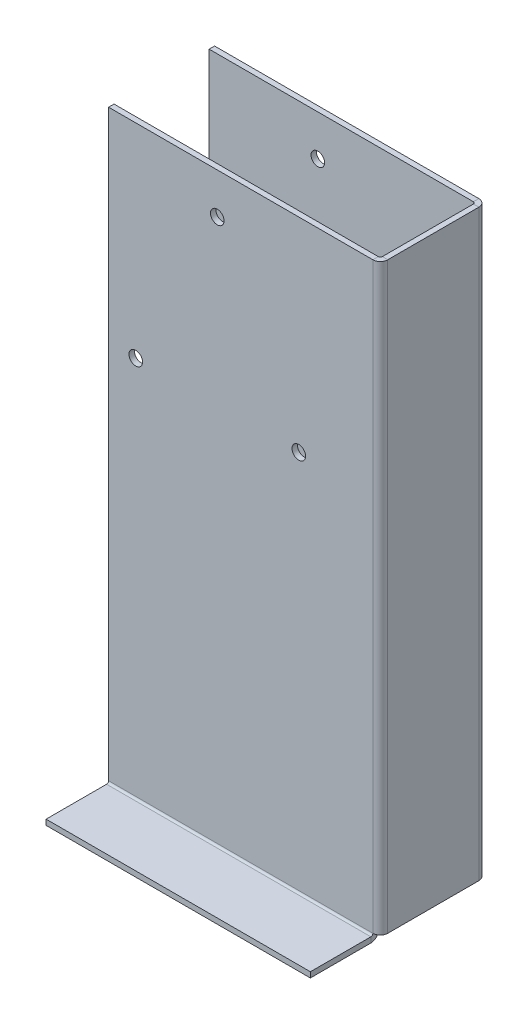
from build123d import *

# Parameters (mm, degrees)
SKETCH1_W                    = 100
SKETCH1_H                    = 214.69
BASE_FLANGE1_DEPTH           = 2
EDGE_FLANGE1_STRIP_W         = 9.4732
EDGE_FLANGE1_STRIP_H         = 2
EDGE_FLANGE1_STRIP_CUT_DEPTH = 214.69
EDGE_FLANGE1_DEPTH           = 214.69
EDGE_FLANGE2_STRIP_W         = 9.4732
EDGE_FLANGE2_STRIP_H         = 2
EDGE_FLANGE2_STRIP_CUT_DEPTH = 214.69
EDGE_FLANGE2_DEPTH           = 214.69
EDGE_FLANGE3_DEPTH           = 97.2634
EDGE_FLANGE3_BEND_DEPTH      = 97.2634
SKETCH18_W                   = 29
SKETCH18_H                   = 2.7366
SKETCH18_W_2                 = 27
CUT_EXTRUDE1_DEPTH           = 25
CUT_EXTRUDE2_REACH           = 246.818
SKETCH19_R                   = 2.5


# Sheet-metal steps are written as plain solids
with BuildPart() as part:
    # Sketch1 → Base-Flange1 (new body)
    with BuildSketch(Plane.XY):
        with Locations((50, 107.345)):
            Rectangle(SKETCH1_W, SKETCH1_H)
    extrude(amount=-BASE_FLANGE1_DEPTH)

    # Edge-Flange1 strip (across the edge) → Edge-Flange1 strip cut (cut)
    with BuildSketch(Plane(origin=(100, 214.69, -2), x_dir=(-1, 0, 0), z_dir=(0, -1, 0))):
        with Locations((-2, -1)):
            Rectangle(EDGE_FLANGE1_STRIP_W, EDGE_FLANGE1_STRIP_H)
    extrude(amount=EDGE_FLANGE1_STRIP_CUT_DEPTH, mode=Mode.SUBTRACT)

    # Edge-Flange1 section (across the edge) → Edge-Flange1 (add)
    with BuildSketch(Plane(origin=(100, 214.69, -2), x_dir=(-1, 0, 0), z_dir=(0, -1, 0))):
        with BuildLine():
            Line((0, 0.7366), (0, 37))
            Line((0, 37), (2, 37))
            Line((2, 37), (2, 0.7366))
            ThreePointArc((2, 0.7366), (2.215745145, 0.215745145), (2.7366, 0))
            Line((2.7366, 0), (2.7366, -2))
            ThreePointArc((2.7366, -2), (0.801531583, -1.198468417), (0, 0.7366))
        make_face()
    extrude(amount=EDGE_FLANGE1_DEPTH)

    # Edge-Flange2 strip (across the edge) → Edge-Flange2 strip cut (cut)
    with BuildSketch(Plane(origin=(98, 214.69, -39), x_dir=(0, 0, 1), z_dir=(0, -1, 0))):
        with Locations((-2, -1)):
            Rectangle(EDGE_FLANGE2_STRIP_W, EDGE_FLANGE2_STRIP_H)
    extrude(amount=EDGE_FLANGE2_STRIP_CUT_DEPTH, mode=Mode.SUBTRACT)

    # Edge-Flange2 section (across the edge) → Edge-Flange2 (add)
    with BuildSketch(Plane(origin=(98, 214.69, -39), x_dir=(0, 0, 1), z_dir=(0, -1, 0))):
        with BuildLine():
            Line((0, 0.7366), (0, 98))
            Line((0, 98), (2, 98))
            Line((2, 98), (2, 0.7366))
            ThreePointArc((2, 0.7366), (2.215745145, 0.215745145), (2.7366, 0))
            Line((2.7366, 0), (2.7366, -2))
            ThreePointArc((2.7366, -2), (0.801531583, -1.198468417), (0, 0.7366))
        make_face()
    extrude(amount=EDGE_FLANGE2_DEPTH)

    # Edge-Flange3 section (across the edge) → Edge-Flange3 (add)
    with BuildSketch(Plane(origin=(0, -0.7366, 0), x_dir=(0, 1, 0), z_dir=(1, 0, 0))):
        with BuildLine():
            Line((-2, 0.7366), (-2, 23))
            Line((-2, 23), (0, 23))
            Line((0, 23), (0, 0.7366))
            ThreePointArc((0, 0.7366), (0.215745145, 0.215745145), (0.7366, 0))
            Line((0.7366, 0), (0.7366, -2))
            ThreePointArc((0.7366, -2), (-1.198468417, -1.198468417), (-2, 0.7366))
        make_face()
    extrude(amount=EDGE_FLANGE3_DEPTH)

    # Edge-Flange3 section 2 (across the edge) → Edge-Flange3 bend (add)
    with BuildSketch(Plane(origin=(97.2634, -0.7366, -39), x_dir=(0, 1, 0), z_dir=(-1, 0, 0))):
        with BuildLine():
            Line((-2, 0.7366), (-2, 23))
            Line((-2, 23), (0, 23))
            Line((0, 23), (0, 0.7366))
            ThreePointArc((0, 0.7366), (0.215745145, 0.215745145), (0.7366, 0))
            Line((0.7366, 0), (0.7366, -2))
            ThreePointArc((0.7366, -2), (-1.198468417, -1.198468417), (-2, 0.7366))
        make_face()
    extrude(amount=EDGE_FLANGE3_BEND_DEPTH)

    # Sketch18 → Cut-Extrude1 (cut)
    with BuildSketch(Plane(origin=(0, -57.7366, -62), x_dir=(1, 0, 0), z_dir=(0, 0, 1))):
        with Locations((82.7634, 56.3683)):
            Rectangle(SKETCH18_W, SKETCH18_H)
        with Locations((13.5, 56.3683)):
            Rectangle(SKETCH18_W_2, SKETCH18_H)
    extrude(amount=CUT_EXTRUDE1_DEPTH, mode=Mode.SUBTRACT)

    # Cut-Extrude2: up to this face of the body (flat: up to its plane)
    cut_extrude2_end = Plane(part.part.faces().sort_by_distance((48.6317, 107.345, -39))[0])
    # Sketch19 → Cut-Extrude2 (cut, up to the picked face)
    with BuildSketch(Plane.XY, mode=Mode.PRIVATE) as cut_extrude2_sk1:
        with Locations((40, 199.69)):
            Circle(SKETCH19_R)
    cut_extrude2_tool1 = split(extrude(cut_extrude2_sk1.sketch, amount=-CUT_EXTRUDE2_REACH, mode=Mode.PRIVATE), bisect_by=cut_extrude2_end, keep=Keep.BOTH, mode=Mode.PRIVATE)
    # Sketch19 → Cut-Extrude2 (cut, up to the picked face)
    with BuildSketch(Plane.XY, mode=Mode.PRIVATE) as cut_extrude2_sk2:
        with Locations((10, 139.69)):
            Circle(SKETCH19_R)
    cut_extrude2_tool2 = split(extrude(cut_extrude2_sk2.sketch, amount=-CUT_EXTRUDE2_REACH, mode=Mode.PRIVATE), bisect_by=cut_extrude2_end, keep=Keep.BOTH, mode=Mode.PRIVATE)
    # Sketch19 → Cut-Extrude2 (cut, up to the picked face)
    with BuildSketch(Plane.XY, mode=Mode.PRIVATE) as cut_extrude2_sk3:
        with Locations((70, 139.69)):
            Circle(SKETCH19_R)
    cut_extrude2_tool3 = split(extrude(cut_extrude2_sk3.sketch, amount=-CUT_EXTRUDE2_REACH, mode=Mode.PRIVATE), bisect_by=cut_extrude2_end, keep=Keep.BOTH, mode=Mode.PRIVATE)
    add(cut_extrude2_tool1.solids().sort_by(Axis((40, 199.69, 0), (0, 0, -1)))[0], mode=Mode.SUBTRACT)
    add(cut_extrude2_tool2.solids().sort_by(Axis((10, 139.69, 0), (0, 0, -1)))[0], mode=Mode.SUBTRACT)
    add(cut_extrude2_tool3.solids().sort_by(Axis((70, 139.69, 0), (0, 0, -1)))[0], mode=Mode.SUBTRACT)


solid = part.part
